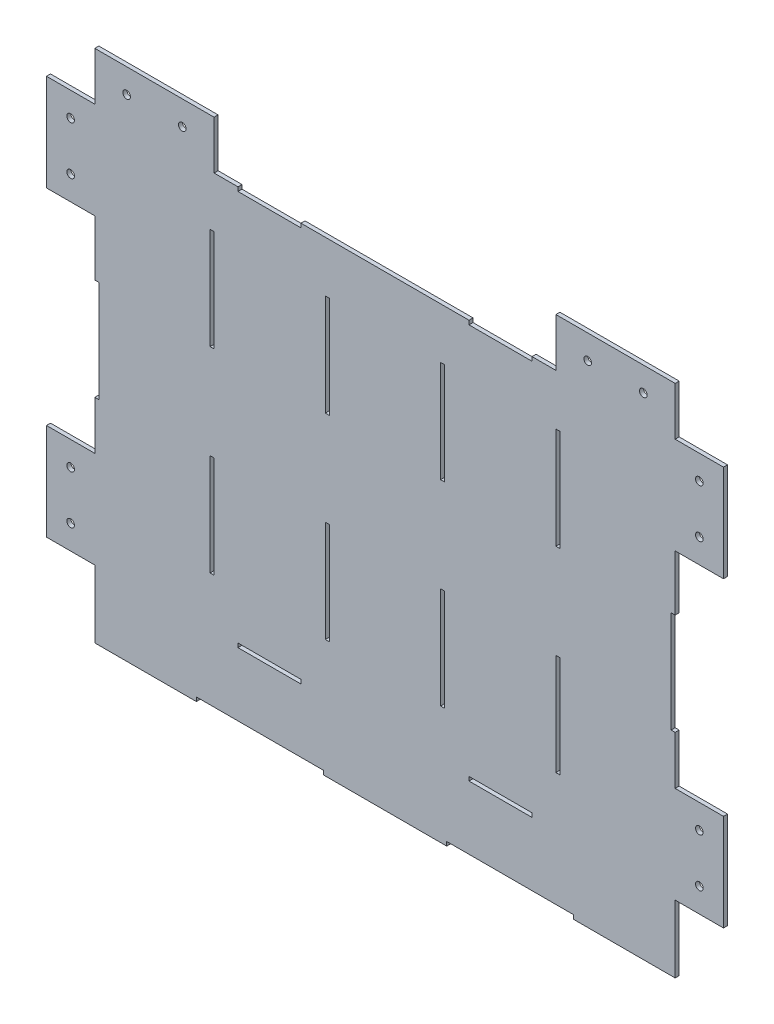
from build123d import *

# Parameters (mm, degrees)
SKETCH1_W                 = 457.223
SKETCH1_H                 = 367.60800004
BOSS_EXTRUDE2_DEPTH       = 3.175
SKETCH4_W                 = 3.175
SKETCH4_H                 = 80
CUT_EXTRUDE1_DEPTH        = 3.175
LPATTERN1_COPY_1_SKETCH_W = 3.175
LPATTERN1_COPY_1_SKETCH_H = 80
LPATTERN1_COPY_1_DEPTH    = 3.175
LPATTERN1_COPY_2_SKETCH_W = 3.175
LPATTERN1_COPY_2_SKETCH_H = 80
LPATTERN1_COPY_2_DEPTH    = 3.175
LPATTERN1_COPY_3_SKETCH_W = 3.175
LPATTERN1_COPY_3_SKETCH_H = 80
LPATTERN1_COPY_3_DEPTH    = 3.175
LPATTERN1_COPY_4_SKETCH_W = 3.175
LPATTERN1_COPY_4_SKETCH_H = 80
LPATTERN1_COPY_4_DEPTH    = 3.175
LPATTERN1_COPY_5_SKETCH_W = 3.175
LPATTERN1_COPY_5_SKETCH_H = 80
LPATTERN1_COPY_5_DEPTH    = 3.175
LPATTERN1_COPY_6_SKETCH_W = 3.175
LPATTERN1_COPY_6_SKETCH_H = 80
LPATTERN1_COPY_6_DEPTH    = 3.175
SKETCH5_W                 = 49.658811606
SKETCH5_H                 = 3.175
CUT_EXTRUDE2_DEPTH        = 3.175
MIRROR3_COPY_1_SKETCH_W   = 49.658811606
MIRROR3_COPY_1_SKETCH_H   = 3.175
MIRROR3_COPY_1_DEPTH      = 3.175
MIRROR3_COPY_2_SKETCH_W   = 49.658811606
MIRROR3_COPY_2_SKETCH_H   = 3.175
MIRROR3_COPY_2_DEPTH      = 3.175
SKETCH6_W                 = 3.175
SKETCH6_H                 = 80
CUT_EXTRUDE3_DEPTH        = 311.705796904
SKETCH7_W                 = 100
SKETCH7_H                 = 3.175
CUT_EXTRUDE4_DEPTH        = 3.175
SKETCH8_W                 = 38.1
SKETCH8_H                 = 76.2
SKETCH8_R                 = 3
SKETCH8_W_2               = 93.98
SKETCH8_H_2               = 38.1
BOSS_EXTRUDE3_DEPTH       = 3.175


with BuildPart() as part:
    # Sketch1 → Boss-Extrude2 (new body)
    with BuildSketch(Plane.XY):
        with Locations((0, -26.588)):
            Rectangle(SKETCH1_W, SKETCH1_H)
    extrude(amount=BOSS_EXTRUDE2_DEPTH)

    # Sketch4 → Cut-Extrude1 (cut)
    with BuildSketch(Plane.XY.offset(3.175)):
        with Locations((-136.213, 77.21600002)):
            Rectangle(SKETCH4_W, SKETCH4_H)
    cut_extrude1 = extrude(amount=-CUT_EXTRUDE1_DEPTH, mode=Mode.SUBTRACT)

    # Mirror1: Cut-Extrude1 across plane
    add(cut_extrude1.mirror(Plane.ZX), mode=Mode.SUBTRACT)

    # LPattern1 copy 1 sketch → LPattern1 copy 1 (cut)
    with BuildSketch(Plane(origin=(90.807, 0, 3.175), x_dir=(1, 0, 0), z_dir=(0, 0, 1))):
        with Locations((-136.213, -77.21600002)):
            Rectangle(LPATTERN1_COPY_1_SKETCH_W, LPATTERN1_COPY_1_SKETCH_H)
    extrude(amount=-LPATTERN1_COPY_1_DEPTH, mode=Mode.SUBTRACT)

    # LPattern1 copy 2 sketch → LPattern1 copy 2 (cut)
    with BuildSketch(Plane(origin=(181.614, 0, 3.175), x_dir=(1, 0, 0), z_dir=(0, 0, 1))):
        with Locations((-136.213, -77.21600002)):
            Rectangle(LPATTERN1_COPY_2_SKETCH_W, LPATTERN1_COPY_2_SKETCH_H)
    extrude(amount=-LPATTERN1_COPY_2_DEPTH, mode=Mode.SUBTRACT)

    # LPattern1 copy 3 sketch → LPattern1 copy 3 (cut)
    with BuildSketch(Plane(origin=(272.421, 0, 3.175), x_dir=(1, 0, 0), z_dir=(0, 0, 1))):
        with Locations((-136.213, -77.21600002)):
            Rectangle(LPATTERN1_COPY_3_SKETCH_W, LPATTERN1_COPY_3_SKETCH_H)
    extrude(amount=-LPATTERN1_COPY_3_DEPTH, mode=Mode.SUBTRACT)

    # LPattern1 copy 4 sketch → LPattern1 copy 4 (cut)
    with BuildSketch(Plane(origin=(90.807, 0, 3.175), x_dir=(1, 0, 0), z_dir=(0, 0, 1))):
        with Locations((-136.213, 77.21600002)):
            Rectangle(LPATTERN1_COPY_4_SKETCH_W, LPATTERN1_COPY_4_SKETCH_H)
    extrude(amount=-LPATTERN1_COPY_4_DEPTH, mode=Mode.SUBTRACT)

    # LPattern1 copy 5 sketch → LPattern1 copy 5 (cut)
    with BuildSketch(Plane(origin=(181.614, 0, 3.175), x_dir=(1, 0, 0), z_dir=(0, 0, 1))):
        with Locations((-136.213, 77.21600002)):
            Rectangle(LPATTERN1_COPY_5_SKETCH_W, LPATTERN1_COPY_5_SKETCH_H)
    extrude(amount=-LPATTERN1_COPY_5_DEPTH, mode=Mode.SUBTRACT)

    # LPattern1 copy 6 sketch → LPattern1 copy 6 (cut)
    with BuildSketch(Plane(origin=(272.421, 0, 3.175), x_dir=(1, 0, 0), z_dir=(0, 0, 1))):
        with Locations((-136.213, 77.21600002)):
            Rectangle(LPATTERN1_COPY_6_SKETCH_W, LPATTERN1_COPY_6_SKETCH_H)
    extrude(amount=-LPATTERN1_COPY_6_DEPTH, mode=Mode.SUBTRACT)

    # Sketch5 → Cut-Extrude2 (cut)
    with BuildSketch(Plane.XY.offset(3.175)):
        with Locations((-91.020094169, -155.62850002)):
            Rectangle(SKETCH5_W, SKETCH5_H)
    cut_extrude2 = extrude(amount=-CUT_EXTRUDE2_DEPTH, mode=Mode.SUBTRACT)

    # Mirror2: Cut-Extrude2 across plane
    add(cut_extrude2.mirror(Plane(origin=(0, 0, 0), x_dir=(0, 0, 1), z_dir=(1, 0, 0))), mode=Mode.SUBTRACT)

    # Mirror3 copy 1 sketch → Mirror3 copy 1 (cut)
    with BuildSketch(Plane(origin=(0, 0, 3.175), x_dir=(-1, 0, 0), z_dir=(0, 0, 1))):
        with Locations((-91.020094169, -155.62850002)):
            Rectangle(MIRROR3_COPY_1_SKETCH_W, MIRROR3_COPY_1_SKETCH_H)
    extrude(amount=-MIRROR3_COPY_1_DEPTH, mode=Mode.SUBTRACT)

    # Mirror3 copy 2 sketch → Mirror3 copy 2 (cut)
    with BuildSketch(Plane.XY.offset(3.175)):
        with Locations((-91.020094169, 155.62850002)):
            Rectangle(MIRROR3_COPY_2_SKETCH_W, MIRROR3_COPY_2_SKETCH_H)
    extrude(amount=-MIRROR3_COPY_2_DEPTH, mode=Mode.SUBTRACT)

    # Sketch6 → Cut-Extrude3 (cut, through all)
    with BuildSketch(Plane.XY.offset(3.175)):
        with Locations((-227.024, -2.78399998)):
            Rectangle(SKETCH6_W, SKETCH6_H)
    cut_extrude3 = extrude(amount=-CUT_EXTRUDE3_DEPTH, mode=Mode.SUBTRACT)

    # Mirror5: Cut-Extrude3 across plane
    add(cut_extrude3.mirror(Plane(origin=(0, 0, 0), x_dir=(0, 0, 1), z_dir=(1, 0, 0))), mode=Mode.SUBTRACT)

    # Sketch7 → Cut-Extrude4 (cut)
    with BuildSketch(Plane.XY.offset(3.175)):
        with Locations((-98.6115, -208.8045)):
            Rectangle(SKETCH7_W, SKETCH7_H)
    cut_extrude4 = extrude(amount=-CUT_EXTRUDE4_DEPTH, mode=Mode.SUBTRACT)

    # Mirror6: Cut-Extrude4 across plane
    add(cut_extrude4.mirror(Plane(origin=(0, 0, 0), x_dir=(0, 0, 1), z_dir=(1, 0, 0))), mode=Mode.SUBTRACT)

    # Sketch8 → Boss-Extrude3 (add)
    # profile 1 of 3: a face of its own
    with BuildSketch(Plane(origin=(0, 0, 0), x_dir=(-1, 0, 0), z_dir=(0, 0, -1))):
        with Locations((-247.6615, 119.11600002)):
            Rectangle(SKETCH8_W, SKETCH8_H)
        with Locations((-247.6615, 100.06600002)):
            Circle(SKETCH8_R, mode=Mode.SUBTRACT)
        with Locations((-247.6615, 138.16600002)):
            Circle(SKETCH8_R, mode=Mode.SUBTRACT)
    # profile 2 of 3: a face of its own
    with BuildSketch(Plane(origin=(0, 0, 0), x_dir=(-1, 0, 0), z_dir=(0, 0, -1))):
        with Locations((-181.6215, 176.26600002)):
            Rectangle(SKETCH8_W_2, SKETCH8_H_2)
        with Locations((-203.529, 176.26600002)):
            Circle(SKETCH8_R, mode=Mode.SUBTRACT)
        with Locations((-159.714, 176.26600002)):
            Circle(SKETCH8_R, mode=Mode.SUBTRACT)
    # profile 3 of 3: a face of its own
    with BuildSketch(Plane(origin=(0, 0, 0), x_dir=(-1, 0, 0), z_dir=(0, 0, -1))):
        with Locations((-247.6615, -119.145240426)):
            Rectangle(SKETCH8_W, SKETCH8_H)
        with Locations((-247.6615, -138.195240426)):
            Circle(SKETCH8_R, mode=Mode.SUBTRACT)
        with Locations((-247.6615, -100.095240426)):
            Circle(SKETCH8_R, mode=Mode.SUBTRACT)
    boss_extrude3 = extrude(amount=-BOSS_EXTRUDE3_DEPTH)

    # Mirror7: Boss-Extrude3 across plane
    add(boss_extrude3.mirror(Plane(origin=(0, 0, 0), x_dir=(0, 0, 1), z_dir=(1, 0, 0))))


solid = part.part
